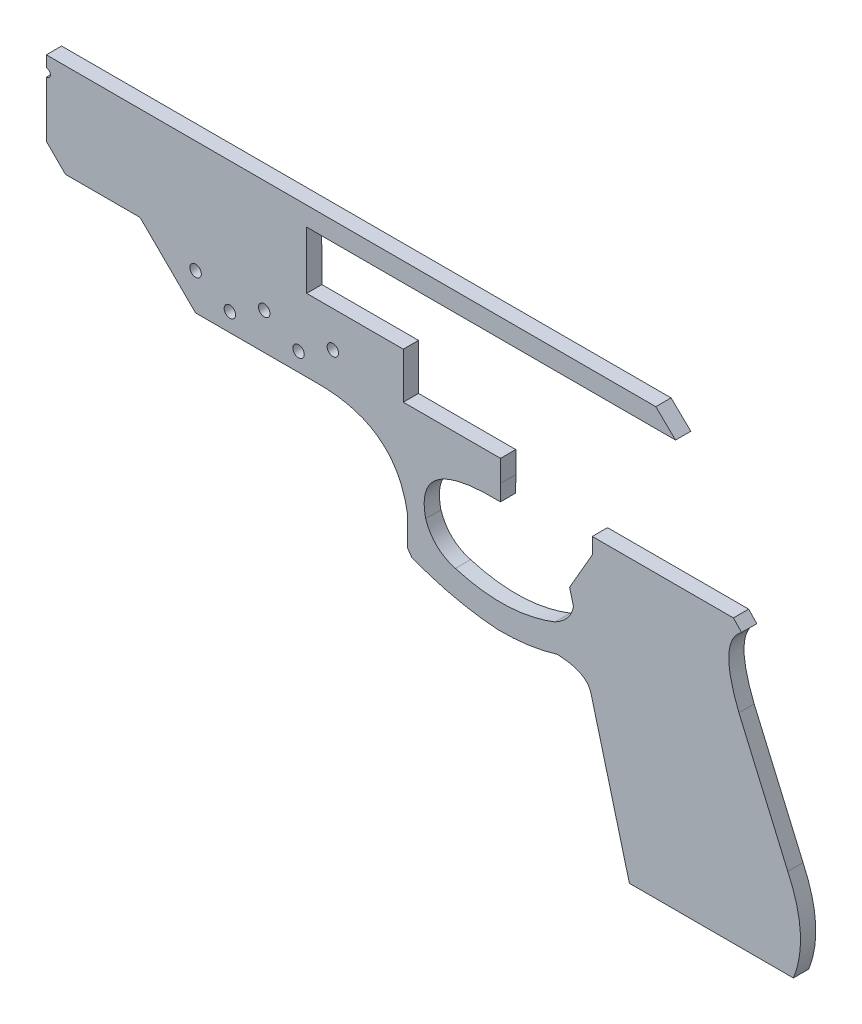
from build123d import *

# Parameters (mm, degrees)
SKETCH1_R           = 15
BOSS_EXTRUDE1_DEPTH = 40


with BuildPart() as part:
    # Sketch1 → Boss-Extrude1 (new body)
    with BuildSketch(Plane.XY):
        with BuildLine():
            Line((2328.193629471, 797.665070151), (2306.644082531, 819.98264411))
            Line((2306.644082531, 819.98264411), (1936.600966183, 819.982644122))
            Line((1936.600966183, 819.982644122), (1936.600966183, 777.982644122))
            Line((1936.600966183, 777.982644122), (1877.049292272, 674.836119232))
            Line((1877.049292272, 674.836119232), (1887.204556022, 636.392194307))
            add(Edge.make_bspline(
                [(1839.028341256, 577.045014524), (1881.43559635, 600.2191041), (1887.204556022, 636.392194307)],
                knots=[0, 0, 0, 0.760505897, 0.760505897, 0.760505897], degree=2))
            add(Edge.make_bspline(
                [(1577.530104584, 567.930861997), (1712.557342233, 527.66528788), (1839.028341256, 577.045014524)],
                knots=[0, 0, 0, 1, 1, 1], degree=2))
            add(Edge.make_bspline(
                [(1499.683598032, 641.815242082), (1519.653389656, 584.068346514), (1577.530104584, 567.930861997)],
                knots=[0, 0, 0, 1, 1, 1], degree=2))
            add(Edge.make_bspline(
                [(1695.292725324, 777.982644122), (1468.390841289, 784.540406299), (1499.683598032, 641.815242082)],
                knots=[0, 0, 0, 1, 1, 1], degree=2))
            Line((1695.292725324, 777.982644122), (1695.773747372, 777.965597041))
            Line((1695.773747372, 777.965597041), (1696.073159669, 819.982644122))
            Line((1696.073159669, 819.982644122), (1696.073159669, 877.037447472))
            Line((1696.073159669, 877.037447472), (1441.073159669, 877.037447472))
            Line((1441.073159669, 877.037447472), (1441.073159669, 997.448610738))
            Line((1441.073159669, 997.448610738), (1187.565465222, 997.448610738))
            Line((1187.565465222, 997.448610738), (1186.991614089, 1147.982644122))
            Line((1186.991614089, 1147.982644122), (2154.99196963, 1147.982644122))
            Line((2154.99196963, 1147.982644122), (2103.235748303, 1197.972230609))
            Line((2103.235748303, 1197.972230609), (504.992691784, 1197.918955689))
            Line((504.992691784, 1197.918955689), (504.992479947, 1168.599995559))
            ThreePointArc((504.992479947, 1168.599995559), (515.673442642, 1157.918954381), (504.992477329, 1147.237915821))
            Line((504.992477329, 1147.237915821), (504.991311411, 1001.506316376))
            Line((504.991311411, 1001.506316376), (554.990911387, 951.505955115))
            Line((554.990911387, 951.505955115), (750.786170947, 951.504540447))
            Line((750.786170947, 951.504540447), (896.36288081, 807.380644179))
            Line((896.36288081, 807.380644179), (1214.094392097, 807.380644179))
            add(Edge.make_bspline(
                [(1452.379086676, 627.629046315), (1422.427096191, 809.110988172), (1214.094392097, 807.380644179)],
                knots=[0, 0, 0, 0.823969697, 0.823969697, 0.823969697], degree=2))
            Line((1452.379086676, 627.629046315), (1452.379086676, 551.12548688))
            Line((1452.379086676, 551.12548688), (1463.316949194, 535.642019159))
            add(Edge.make_bspline(
                [(1463.316949194, 535.642019159), (1573.701640747, 492.381186031), (1689.373161993, 484.664146685)],
                knots=[0, 0, 0, 1, 1, 1], degree=2))
            add(Edge.make_bspline(
                [(1689.373161993, 484.664146685), (1769.523102644, 483.462442752), (1844.488219366, 506.217378346)],
                knots=[0, 0, 0, 1, 1, 1], degree=2))
            add(Edge.make_bspline(
                [(1844.488219366, 506.217378346), (1895.548903243, 504.844258701), (1925.130134309, 490.155237634), (1933.231912571, 462.150315104)],
                knots=[0, 0, 0, 0, 0.72611761, 0.72611761, 0.72611761, 0.72611761], degree=3))
            add(Edge.make_bspline(
                [(1933.231912571, 462.150315104), (1933.460105495, 461.36153455), (1933.671258525, 460.562190341), (1933.865371664, 459.752282477)],
                knots=[0.72611761, 0.72611761, 0.72611761, 0.72611761, 0.746569281, 0.746569281, 0.746569281, 0.746569281], degree=3))
            Line((1933.865371664, 459.752282477), (2033.943360847, 80.895484918))
            Line((2033.943360847, 80.895484918), (2463.943360308, 80.873953568))
            add(Edge.make_bspline(
                [(2449.362223907, 315.534562303), (2507.628902522, 190.098238449), (2463.943360308, 80.873953568)],
                knots=[0, 0, 0, 1, 1, 1], degree=2))
            Line((2449.362223907, 315.534562303), (2321.11971702, 611.9262278))
            add(Edge.make_bspline(
                [(2321.11971702, 611.9262278), (2264.607879649, 751.5529571), (2328.193629471, 797.665070151)],
                knots=[0, 0, 0, 0.701234355, 0.701234355, 0.701234355], degree=2))
        make_face()
        with Locations((986.36288081, 855.380644179)):
            Circle(SKETCH1_R, mode=Mode.SUBTRACT)
        with Locations((896.36288081, 903.380644179)):
            Circle(SKETCH1_R, mode=Mode.SUBTRACT)
        with Locations((1076.36288081, 903.380644179)):
            Circle(SKETCH1_R, mode=Mode.SUBTRACT)
        with Locations((1166.36288081, 855.380644179)):
            Circle(SKETCH1_R, mode=Mode.SUBTRACT)
        with Locations((1256.36288081, 903.380644179)):
            Circle(SKETCH1_R, mode=Mode.SUBTRACT)
    extrude(amount=BOSS_EXTRUDE1_DEPTH)


solid = part.part
